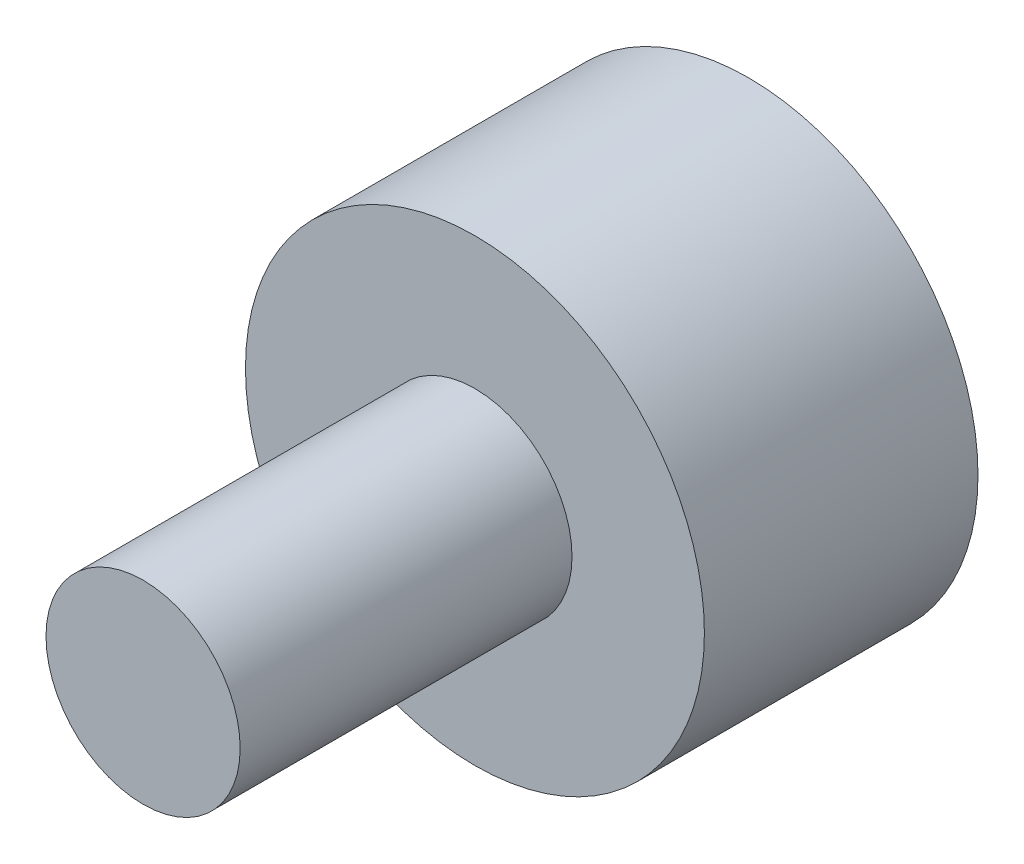
from build123d import *

# Parameters (mm, degrees)
Y_KSEKLIK_EKSTR_ZYON1_DEPTH = 10


# Read off the part's stored shape, not the designer's step: Döndür-İnce1
with BuildPart() as part:
    # Döndür-İnce1 outline → Döndür-İnce1 (revolve)
    with BuildSketch(Plane.XZ):
        with BuildLine():
            Line((0, 265.5), (0, 255.5))
            Line((0, 255.5), (45, 255.5))
            Line((45, 255.5), (45, 67.5))
            Line((45, 67.5), (120, 67.5))
            Line((120, 67.5), (120, -67.5))
            Line((120, -67.5), (107.149606299, -67.5))
            Line((107.149606299, -67.5), (107.149606299, 7.5))
            Line((107.149606299, 7.5), (87.149606299, 7.5))
            Line((87.149606299, 7.5), (87.149606299, -32.5))
            ThreePointArc((87.149606299, -32.5), (81.291741923, -46.642135624), (67.149606299, -52.5))
            Line((67.149606299, -52.5), (57.149606299, -52.5))
            ThreePointArc((57.149606299, -52.5), (43.007470675, -46.642135624), (37.149606299, -32.5))
            Line((37.149606299, -32.5), (37.149606299, 7.5))
            Line((37.149606299, 7.5), (17.149606299, 7.5))
            Line((17.149606299, 7.5), (17.149606299, -67.5))
            Line((17.149606299, -67.5), (0, -67.5))
            Line((0, -67.5), (0, -77.5))
            Line((0, -77.5), (27.149606299, -77.5))
            Line((27.149606299, -77.5), (27.149606299, -32.5))
            ThreePointArc((27.149606299, -32.5), (35.936402864, -53.713203435), (57.149606299, -62.5))
            Line((57.149606299, -62.5), (67.149606299, -62.5))
            ThreePointArc((67.149606299, -62.5), (88.362809735, -53.713203436), (97.149606299, -32.5))
            Line((97.149606299, -32.5), (97.149606299, -77.5))
            Line((97.149606299, -77.5), (130, -77.5))
            Line((130, -77.5), (130, 77.5))
            Line((130, 77.5), (55, 77.5))
            Line((55, 77.5), (55, 265.5))
            Line((55, 265.5), (0, 265.5))
        make_face()
    revolve(axis=Axis((0, 0, 0), (0, 0, 1)))

    # Çizim2 → Yükseklik-Ekstrüzyon1 (add)
    with BuildSketch(Plane(origin=(0, 0, -62.5), x_dir=(-1, 0, 0), z_dir=(0, 0, -1))):
        Polygon((62.149606299, -13.529902504), (71.716692108, -9.567085809), (75.679508803, 0), (71.716692108, 9.567085809), (62.149606299, 13.529902504), (52.58252049, 9.567085809), (48.619703796, 0), (52.58252049, -9.567085809), align=None)
        Polygon((53.513493871, -53.513493871), (57.476310566, -43.946408062), (53.513493871, -34.379322253), (43.946408062, -30.416505559), (34.379322253, -34.379322253), (30.416505559, -43.946408062), (34.379322253, -53.513493871), (43.946408062, -57.476310566), align=None)
        Polygon((0, -75.679508803), (9.567085809, -71.716692108), (13.529902504, -62.149606299), (9.567085809, -52.58252049), (0, -48.619703796), (-9.567085809, -52.58252049), (-13.529902504, -62.149606299), (-9.567085809, -71.716692108), align=None)
        Polygon((-53.513493871, -53.513493871), (-43.946408062, -57.476310566), (-34.379322253, -53.513493871), (-30.416505559, -43.946408062), (-34.379322253, -34.379322253), (-43.946408062, -30.416505559), (-53.513493871, -34.379322253), (-57.476310566, -43.946408062), align=None)
        Polygon((-75.679508803, 0), (-71.716692108, -9.567085809), (-62.149606299, -13.529902504), (-52.58252049, -9.567085809), (-48.619703796, 0), (-52.58252049, 9.567085809), (-62.149606299, 13.529902504), (-71.716692108, 9.567085809), align=None)
        Polygon((-53.513493871, 53.513493871), (-57.476310566, 43.946408062), (-53.513493871, 34.379322253), (-43.946408062, 30.416505559), (-34.379322253, 34.379322253), (-30.416505559, 43.946408062), (-34.379322253, 53.513493871), (-43.946408062, 57.476310566), align=None)
        Polygon((0, 75.679508803), (-9.567085809, 71.716692108), (-13.529902504, 62.149606299), (-9.567085809, 52.58252049), (0, 48.619703796), (9.567085809, 52.58252049), (13.529902504, 62.149606299), (9.567085809, 71.716692108), align=None)
        Polygon((53.513493871, 53.513493871), (43.946408062, 57.476310566), (34.379322253, 53.513493871), (30.416505559, 43.946408062), (34.379322253, 34.379322253), (43.946408062, 30.416505559), (53.513493871, 34.379322253), (57.476310566, 43.946408062), align=None)
    extrude(amount=Y_KSEKLIK_EKSTR_ZYON1_DEPTH)


solid = part.part
